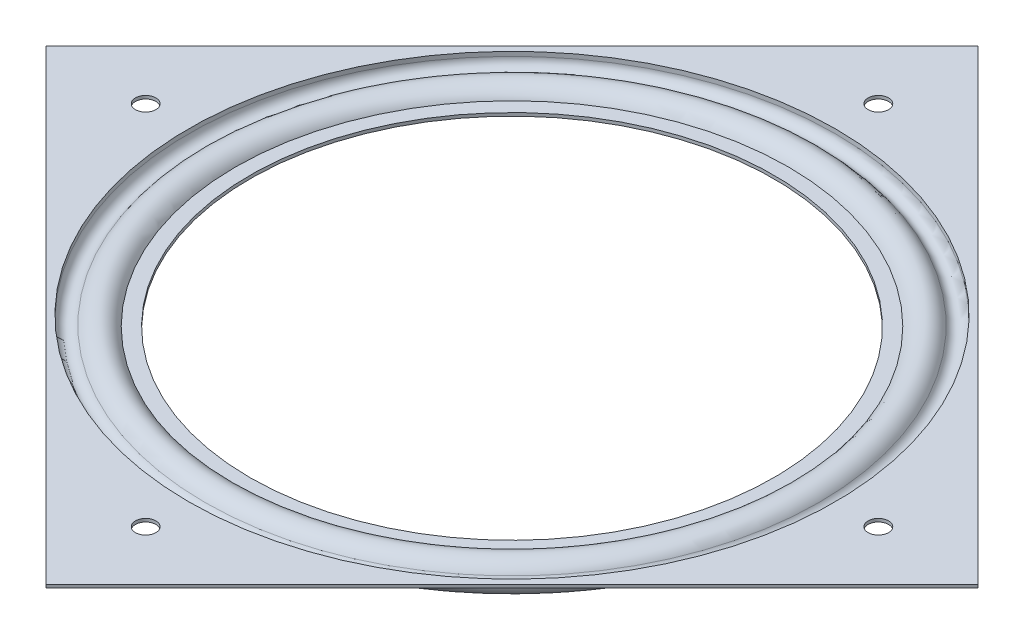
from build123d import *

# Parameters (mm, degrees)
SKETCH2_W                                 = 154.0002
SKETCH2_H                                 = 154.0002
SKETCH2_R                                 = 75.529340861
EXTRUDE1_DEPTH                            = 0.7366
EXTRUDE2_START                            = -0.7366
SKETCH3_R                                 = 75.529340861
EXTRUDE2_DEPTH                            = 0.7366
CIRPATTERN1_COUNT                         = 6
SKETCH5_W                                 = 3.3782
SKETCH5_H                                 = 0.7366
F_5_32_0_156250_DIAMETER_HOLE1_AT_2_COUNT = 2
F_5_32_0_156250_DIAMETER_HOLE1_AT_2_PITCH = 141.3002
F_5_32_0_156250_DIAMETER_HOLE1_AT_3_COUNT = 2
F_5_32_0_156250_DIAMETER_HOLE1_AT_3_PITCH = 141.3002
F_5_32_0_156250_DIAMETER_HOLE1_AT_4_COUNT = 2
F_5_32_0_156250_DIAMETER_HOLE1_AT_4_PITCH = 199.828659206
SKETCH7_W                                 = 2.3876
SKETCH7_H                                 = 8.128
F_5_32_0_156250_DIAMETER_HOLE2_AT_2_COUNT = 2
F_5_32_0_156250_DIAMETER_HOLE2_AT_2_PITCH = 121.0564
F_5_32_0_156250_DIAMETER_HOLE2_AT_3_COUNT = 2
F_5_32_0_156250_DIAMETER_HOLE2_AT_3_PITCH = 171.199602692
F_5_32_0_156250_DIAMETER_HOLE2_AT_4_COUNT = 2
F_5_32_0_156250_DIAMETER_HOLE2_AT_4_PITCH = 121.0564
CIRPATTERN2_COUNT                         = 4


# Read off the part's stored shape, not the designer's step: Revolve-Thin5
with BuildPart() as part:
    # Sketch1 → Revolve-Thin4 (revolve)
    with BuildSketch(Plane.XY, mode=Mode.PRIVATE) as revolve_thin4_sk:
        with BuildLine():
            Line((62.74854946, 1.778), (61.214, 1.778))
            ThreePointArc((61.214, 1.778), (59.436, 0), (61.214, -1.778))
            Line((61.214, -1.778), (64.28309892, -1.778))
            ThreePointArc((64.28309892, -1.778), (67.669225582, -4.788771381), (71.737577241, -2.794))
            ThreePointArc((71.737577241, -2.794), (74.023261161, -1.847238721), (75.529340861, -3.81))
            Line((75.529340861, -3.81), (75.529340861, -4.826))
            Line((75.529340861, -4.826), (77.0001, -4.826))
            Line((77.0001, -4.826), (77.0001, -4.0894))
            Line((77.0001, -4.0894), (76.265940861, -4.0894))
            Line((76.265940861, -4.0894), (76.265940861, -3.81))
            ThreePointArc((76.265940861, -3.81), (74.21390727, -1.135737757), (71.099662929, -2.4257))
            ThreePointArc((71.099662929, -2.4257), (67.492675346, -4.00937161), (64.902401285, -1.0414))
            Line((64.902401285, -1.0414), (61.214, -1.0414))
            ThreePointArc((61.214, -1.0414), (60.1726, 0), (61.214, 1.0414))
            Line((61.214, 1.0414), (62.74854946, 1.0414))
            Line((62.74854946, 1.0414), (62.74854946, 1.778))
        make_face()
    revolve(revolve_thin4_sk.sketch.rotate(Axis((0, 21.71272626, 0), (0, -1, 0)), 90), axis=Axis((0, 21.71272626, 0), (0, -1, 0)))

    # Sketch2 → Extrude1 (add)
    with BuildSketch(Plane.XZ.offset(4.826)):
        Rectangle(SKETCH2_W, SKETCH2_H)
        with Locations(Location((0, 0, 0), (0, 0, 90))):
            Circle(SKETCH2_R, mode=Mode.SUBTRACT)
    extrude(amount=-EXTRUDE1_DEPTH)

    # Sketch5 → 5/32 (0.156250) Diameter Hole1 (revolve, cut)
    with BuildSketch(Plane(origin=(70.6501, -4.0894, -70.6501), x_dir=(0, 0, 1), z_dir=(1, 0, 0))):
        with Locations((1.6891, 0.3683)):
            Rectangle(SKETCH5_W, SKETCH5_H)
    f_5_32_0_156250_diameter_hole1 = revolve(axis=Axis((70.6501, 2.2606, -70.6501), (0, -1, 0)), mode=Mode.SUBTRACT)

    # 5/32 (0.156250) Diameter Hole1 at 2: 5/32 (0.156250) Diameter Hole1 ×2
    with Locations(*[(0, 0, i * F_5_32_0_156250_DIAMETER_HOLE1_AT_2_PITCH) for i in range(1, F_5_32_0_156250_DIAMETER_HOLE1_AT_2_COUNT)]):
        add(f_5_32_0_156250_diameter_hole1, mode=Mode.SUBTRACT)

    # 5/32 (0.156250) Diameter Hole1 at 3: 5/32 (0.156250) Diameter Hole1 ×2
    with Locations(*[(-i * F_5_32_0_156250_DIAMETER_HOLE1_AT_3_PITCH, 0, 0) for i in range(1, F_5_32_0_156250_DIAMETER_HOLE1_AT_3_COUNT)]):
        add(f_5_32_0_156250_diameter_hole1, mode=Mode.SUBTRACT)

    # 5/32 (0.156250) Diameter Hole1 at 4: 5/32 (0.156250) Diameter Hole1 ×2
    with Locations(*[Vector(-0.7071067811865476, 0, 0.7071067811865476) * (i * F_5_32_0_156250_DIAMETER_HOLE1_AT_4_PITCH) for i in range(1, F_5_32_0_156250_DIAMETER_HOLE1_AT_4_COUNT)]):
        add(f_5_32_0_156250_diameter_hole1, mode=Mode.SUBTRACT)

    # Sketch11 → 3/32 (0.093750) Diameter Hole2 (revolve, cut)
    with BuildSketch(Plane(origin=(-70.2437, -4.0894, -61.1251), x_dir=(0, 0, 1), z_dir=(1, 0, 0))):
        Polygon((0, 0), (0, 26.115399675), (1.190625, 25.4), (1.190625, 0), align=None)
    f_3_32_0_093750_diameter_hole2 = revolve(axis=Axis((-70.2437, 2.2606, -61.1251), (0, -1, 0)), mode=Mode.SUBTRACT)

    # CirPattern2: 3/32 (0.093750) Diameter Hole2 ×4 about axis
    cirpattern2_axis = Axis((0, 0, 0), (0, 1, 0))
    for i in range(1, CIRPATTERN2_COUNT):
        add(f_3_32_0_093750_diameter_hole2.rotate(cirpattern2_axis, i * 360 / CIRPATTERN2_COUNT), mode=Mode.SUBTRACT)


with BuildPart() as body_2:
    # Revolve-Thin5 outline → Revolve-Thin5 (revolve)
    with BuildSketch(Plane.XY):
        with BuildLine():
            Line((77.0001, 3.302), (75.529340861, 3.302))
            Line((75.529340861, 3.302), (75.529340861, 2.286))
            ThreePointArc((75.529340861, 2.286), (74.023261161, 0.323238721), (71.737577241, 1.27))
            ThreePointArc((71.737577241, 1.27), (68.088390068, 3.299931105), (64.576093872, 1.0414))
            Line((64.576093872, 1.0414), (61.214, 1.0414))
            Line((61.214, 1.0414), (61.214, 0.3048))
            Line((61.214, 0.3048), (65.066299927, 0.3048))
            ThreePointArc((65.066299927, 0.3048), (67.890458911, 2.54923464), (71.099662929, 0.9017))
            ThreePointArc((71.099662929, 0.9017), (74.21390727, -0.388262243), (76.265940861, 2.286))
            Line((76.265940861, 2.286), (76.265940861, 2.5654))
            Line((76.265940861, 2.5654), (77.0001, 2.5654))
            Line((77.0001, 2.5654), (77.0001, 3.302))
        make_face()
    revolve(axis=Axis((0, 0, 0), (0, 1, 0)))

    # Sketch3 → Extrude2 (add)
    with BuildSketch(Plane(origin=(0, 3.302, 0), x_dir=(-1, 0, 0), z_dir=(0, 1, 0)).offset(EXTRUDE2_START)):
        Polygon((0, -108.894585724), (108.894585724, 0), (0, 108.894585724), (-108.894585724, 0), align=None)
        with Locations(Location((0, 0, 0), (0, 0, 90))):
            Circle(SKETCH3_R, mode=Mode.SUBTRACT)
    extrude(amount=EXTRUDE2_DEPTH)

    # Sketch7 → 5/32 (0.156250) Diameter Hole2 (revolve, cut)
    with BuildSketch(Plane(origin=(85.599801346, 3.302, 0), x_dir=(0, 0, 1), z_dir=(1, 0, 0))):
        with Locations((1.1938, 4.064)):
            Rectangle(SKETCH7_W, SKETCH7_H)
    f_5_32_0_156250_diameter_hole2 = revolve(axis=Axis((85.599801346, 9.652, 0), (0, -1, 0)), mode=Mode.SUBTRACT)

    # 5/32 (0.156250) Diameter Hole2 at 2: 5/32 (0.156250) Diameter Hole2 ×2
    with Locations(*[Vector(-0.7071067811865476, 0, -0.7071067811865476) * (i * F_5_32_0_156250_DIAMETER_HOLE2_AT_2_PITCH) for i in range(1, F_5_32_0_156250_DIAMETER_HOLE2_AT_2_COUNT)]):
        add(f_5_32_0_156250_diameter_hole2, mode=Mode.SUBTRACT)

    # 5/32 (0.156250) Diameter Hole2 at 3: 5/32 (0.156250) Diameter Hole2 ×2
    with Locations(*[(-i * F_5_32_0_156250_DIAMETER_HOLE2_AT_3_PITCH, 0, 0) for i in range(1, F_5_32_0_156250_DIAMETER_HOLE2_AT_3_COUNT)]):
        add(f_5_32_0_156250_diameter_hole2, mode=Mode.SUBTRACT)

    # 5/32 (0.156250) Diameter Hole2 at 4: 5/32 (0.156250) Diameter Hole2 ×2
    with Locations(*[Vector(-0.7071067811865476, 0, 0.7071067811865476) * (i * F_5_32_0_156250_DIAMETER_HOLE2_AT_4_PITCH) for i in range(1, F_5_32_0_156250_DIAMETER_HOLE2_AT_4_COUNT)]):
        add(f_5_32_0_156250_diameter_hole2, mode=Mode.SUBTRACT)


with BuildPart() as body_3:
    # Sketch4 → Revolve1 (revolve)
    with BuildSketch(Plane.XY):
        with BuildLine():
            Line((68.21805, 2.5146), (68.21805, -4.0386))
            ThreePointArc((68.21805, -4.0386), (71.49465, -0.762), (68.21805, 2.5146))
        make_face()
    revolve(axis=Axis((68.21805, 2.837450101, 0), (0, -1, 0)))


with BuildPart() as cirpattern1_1:
    # CirPattern1: pattern copy
    add(body_3.part.rotate(Axis((0, 0, 0), (0, 1, 0)), 1 * 360 / CIRPATTERN1_COUNT))


with BuildPart() as cirpattern1_2:
    # CirPattern1: pattern copy
    add(body_3.part.rotate(Axis((0, 0, 0), (0, 1, 0)), 2 * 360 / CIRPATTERN1_COUNT))


with BuildPart() as cirpattern1_3:
    # CirPattern1: pattern copy
    add(body_3.part.rotate(Axis((0, 0, 0), (0, 1, 0)), 3 * 360 / CIRPATTERN1_COUNT))


with BuildPart() as cirpattern1_4:
    # CirPattern1: pattern copy
    add(body_3.part.rotate(Axis((0, 0, 0), (0, 1, 0)), 4 * 360 / CIRPATTERN1_COUNT))


with BuildPart() as cirpattern1_5:
    # CirPattern1: pattern copy
    add(body_3.part.rotate(Axis((0, 0, 0), (0, 1, 0)), 5 * 360 / CIRPATTERN1_COUNT))


solid = body_2.part
